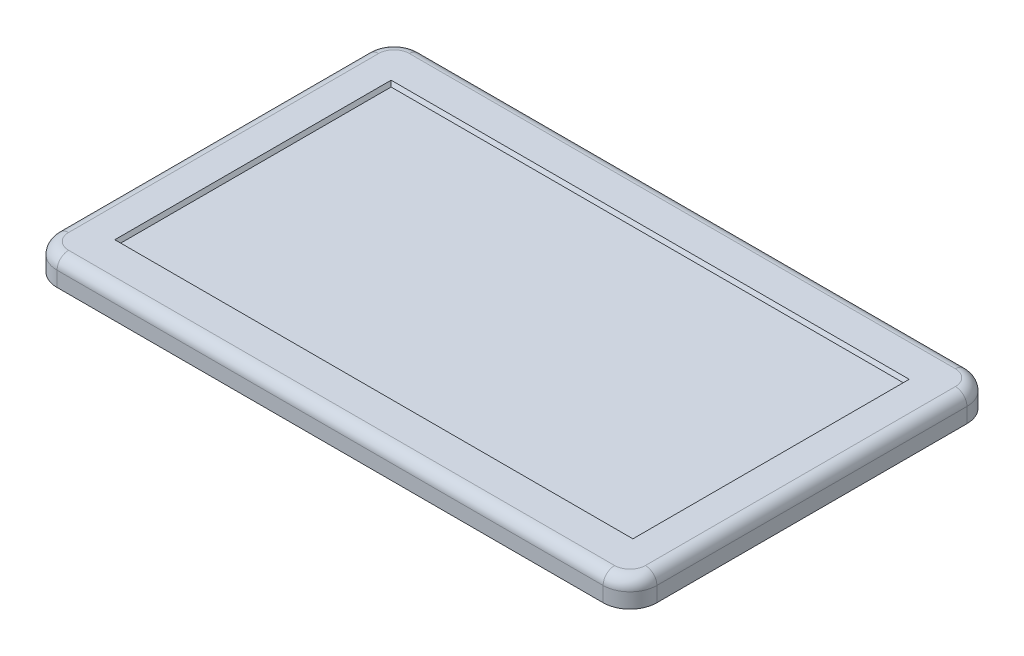
from build123d import *

# Parameters (mm, degrees)
BOSS_EXTRUDE1_DEPTH = 14.605
FILLET1_R           = 6.35
CUT_EXTRUDE1_DEPTH  = 12.7
SKETCH5_W           = 290.733643468
SKETCH5_H           = 157.6979616
BOSS_EXTRUDE2_DEPTH = 1.905
FILLET2_R           = 2.54


with BuildPart() as part:
    # Sketch1 → Boss-Extrude1 (new body)
    with BuildSketch(Plane(origin=(0, 0, 0), x_dir=(1, 0, 0), z_dir=(0, 1, 0))):
        with BuildLine():
            Line((-150.5839, -100.33), (150.5839, -100.33))
            ThreePointArc((150.5839, -100.33), (161.072839149, -95.985339149), (165.4175, -85.4964))
            Line((165.4175, -85.4964), (165.4175, 85.4964))
            ThreePointArc((165.4175, 85.4964), (161.072839149, 95.985339149), (150.5839, 100.33))
            Line((150.5839, 100.33), (-150.5839, 100.33))
            ThreePointArc((-150.5839, 100.33), (-161.072839149, 95.985339149), (-165.4175, 85.4964))
            Line((-165.4175, 85.4964), (-165.4175, -85.4964))
            ThreePointArc((-165.4175, -85.4964), (-161.072839149, -95.985339149), (-150.5839, -100.33))
        make_face()
    extrude(amount=BOSS_EXTRUDE1_DEPTH)

    # Fillet1
    fillet1_edges = [part.edges().sort_by_distance(p)[0] for p in [
        (161.072839149, 14.605, -95.985339149),
        (0, 14.605, -100.33),
        (-161.072839149, 14.605, -95.985339149),
        (-165.4175, 14.605, 0),
        (-161.072839149, 14.605, 95.985339149),
        (0, 14.605, 100.33),
        (161.072839149, 14.605, 95.985339149),
        (165.4175, 14.605, 0),
    ]]
    fillet(fillet1_edges, radius=FILLET1_R)

    # Sketch2 → Cut-Extrude1 (cut)
    with BuildSketch(Plane.XZ):
        with BuildLine():
            Line((-148.6789, -98.425), (148.6789, -98.425))
            ThreePointArc((148.6789, -98.425), (159.167839149, -94.080339149), (163.5125, -83.5914))
            Line((163.5125, -83.5914), (163.5125, 83.5914))
            ThreePointArc((163.5125, 83.5914), (159.167839149, 94.080339149), (148.6789, 98.425))
            Line((148.6789, 98.425), (-148.6789, 98.425))
            ThreePointArc((-148.6789, 98.425), (-159.167839149, 94.080339149), (-163.5125, 83.5914))
            Line((-163.5125, 83.5914), (-163.5125, -83.5914))
            ThreePointArc((-163.5125, -83.5914), (-159.167839149, -94.080339149), (-148.6789, -98.425))
        make_face()
    extrude(amount=-CUT_EXTRUDE1_DEPTH, mode=Mode.SUBTRACT)

    # Sketch3 → Cut-Loft1 section 0
    with BuildSketch(Plane(origin=(0, 14.605, 0), x_dir=(1, 0, 0), z_dir=(0, 1, 0))):
        with BuildLine():
            Line((-142.875, -76.2), (142.875, -76.2))
            Line((142.875, -76.2), (142.875, 76.2))
            Line((142.875, 76.2), (-142.875, 76.2))
            Line((-142.875, 76.2), (-142.875, -76.2))
        make_face()
    # Sketch4 → Cut-Loft1 section 1
    with BuildSketch(Plane(origin=(0, 10.16, 0), x_dir=(1, 0, 0), z_dir=(0, 1, 0))):
        with BuildLine():
            Line((-139.7, -73.025), (139.7, -73.025))
            Line((139.7, -73.025), (139.7, 73.025))
            Line((139.7, 73.025), (-139.7, 73.025))
            Line((-139.7, 73.025), (-139.7, -73.025))
        make_face()
    loft(mode=Mode.SUBTRACT)

    # Sketch5 → Boss-Extrude2 (add)
    with BuildSketch(Plane.XZ.offset(-12.7)):
        Rectangle(SKETCH5_W, SKETCH5_H)
    extrude(amount=BOSS_EXTRUDE2_DEPTH)

    # Fillet2
    # the kernel refuses this fillet: 2.54 mm, written as the material it takes off along each edge
    with BuildSketch(Plane(origin=(151.515182796, 10.795, -78.8489808), x_dir=(0, 1, 0), z_dir=(-1, 0, 0)), Plane(origin=(-151.515182796, 10.795, 78.8489808), x_dir=(0, 1, 0), z_dir=(1, 0, 0))) as fillet2_piece_1:
        with BuildLine():
            CenterArc((2.54, -2.459344425), FILLET2_R, 104.477512186, 75.522487814)
            Line((0, -2.459344425), (-0.0508, -2.459344425))
            Line((-0.0508, -2.459344425), (-0.0508, 0))
            Line((-0.0508, 0), (0, 0.0508))
            ThreePointArc((0, 0.0508), (0.9525, 0.0508), (1.8923, 0.049186888))
            Line((1.8923, 0.049186888), (1.905, 0))
        make_face()
    extrude(amount=303.030365593, mode=Mode.SUBTRACT)
    with BuildSketch(Plane(origin=(-145.366821734, 10.795, -84.997341863), x_dir=(0, 1, 0), z_dir=(0, 0, 1)), Plane(origin=(145.366821734, 10.795, 84.997341863), x_dir=(0, 1, 0), z_dir=(0, 0, -1))) as fillet2_piece_2:
        with BuildLine():
            CenterArc((2.54, -2.459344425), FILLET2_R, 104.477512186, 75.522487814)
            Line((0, -2.459344425), (-0.0508, -2.459344425))
            Line((-0.0508, -2.459344425), (-0.0508, 0))
            Line((-0.0508, 0), (0, 0.0508))
            ThreePointArc((0, 0.0508), (0.9525, 0.0508), (1.8923, 0.049186888))
            Line((1.8923, 0.049186888), (1.905, 0))
        make_face()
    extrude(amount=169.994683725, mode=Mode.SUBTRACT)


solid = part.part
